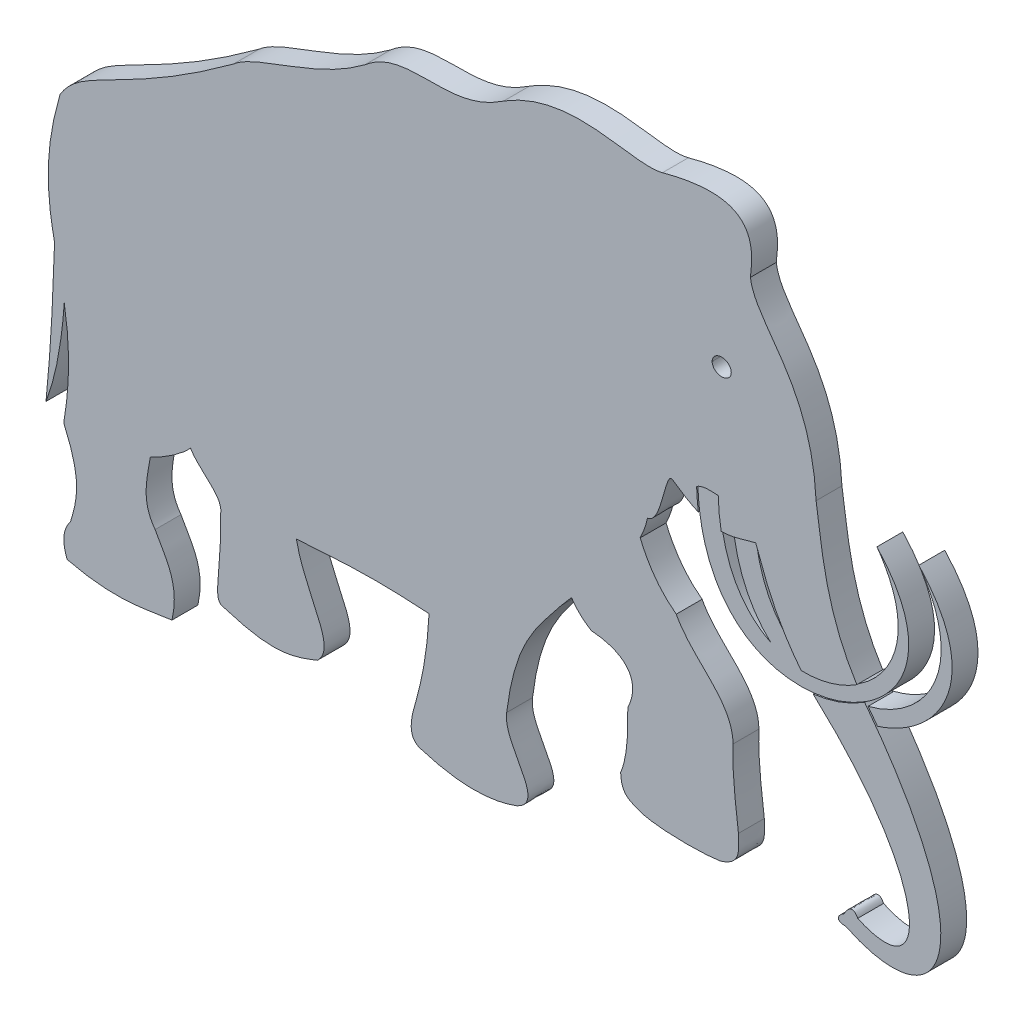
from build123d import *

# Parameters (mm, degrees)
BOSS_EXTRU_1_DEPTH   = 20
BOSS_EXTRU_1_2_DEPTH = 20
BOSS_EXTRU_2_DEPTH   = 19
BOSS_EXTRU_3_DEPTH   = 1


with BuildPart() as part:
    # Model → Boss.-Extru.1 (new body)
    with BuildSketch(Plane.XY):
        with BuildLine():
            add(Edge.make_bspline(
                [(398.406344944, -335.551266819), (400.72538222, -332.644229678), (403.475984858, -329.492972635), (406.519923296, -326.134282474)],
                knots=[14, 14, 14, 14, 14.131970446, 14.131970446, 14.131970446, 14.131970446], degree=3))
            add(Edge.make_bspline(
                [(406.519923296, -326.134282474), (409.776017564, -330.935959056), (413.953457492, -335.737862069), (421.868823242, -340.539765082)],
                knots=[0.45228017, 0.45228017, 0.45228017, 0.45228017, 1, 1, 1, 1], degree=3))
            add(Edge.make_bspline(
                [(421.868823242, -340.539765082), (445.982080078, -342.338104926), (461.195277235, -354.181309679), (450.068307834, -377.996221246)],
                knots=[1, 1, 1, 1, 2, 2, 2, 2], degree=3))
            add(Edge.make_bspline(
                [(450.068307834, -377.996221246), (449.726898872, -393.404755317), (450.721497938, -408.812944878), (444.522048611, -424.220100911)],
                knots=[2, 2, 2, 2, 3, 3, 3, 3], degree=3))
            add(Edge.make_bspline(
                [(444.522048611, -424.220100911), (444.876548937, -432.76187066), (447.047992622, -438.134152561), (455.1543023, -440.956719293)],
                knots=[3, 3, 3, 3, 4, 4, 4, 4], degree=3))
            add(Edge.make_bspline(
                [(455.1543023, -440.956719293), (467.638294813, -448.259632704), (510.63274197, -447.030767144), (521.728016493, -444.940972222)],
                knots=[4, 4, 4, 4, 5, 5, 5, 5], degree=3))
            add(Edge.make_bspline(
                [(521.728016493, -444.940972222), (538.792952474, -439.739222548), (535.34647895, -429.681610786), (535.595214844, -419.438652886)],
                knots=[5, 5, 5, 5, 6, 6, 6, 6], degree=3))
            add(Edge.make_bspline(
                [(535.595214844, -419.438652886), (534.055946181, -404.829725477), (530.511631944, -383.704399957), (531.437673611, -361.659233941)],
                knots=[6, 6, 6, 6, 7, 7, 7, 7], degree=3))
            add(Edge.make_bspline(
                [(531.437673611, -361.659233941), (530.897827148, -333.355018446), (499.979128689, -320.640549045), (487.516840278, -296.706092665)],
                knots=[7, 7, 7, 7, 8, 8, 8, 8], degree=3))
            add(Edge.make_bspline(
                [(487.516840278, -296.706092665), (473.931190857, -286.590161181), (465.776068868, -273.993395692), (459.640748441, -259.547435467)],
                knots=[8, 8, 8, 8, 8.693102404, 8.693102404, 8.693102404, 8.693102404], degree=3))
            add(Edge.make_bspline(
                [(459.640748441, -259.547435467), (462.251610075, -254.159049239), (464.222819066, -248.757530234), (465.321123589, -243.404953342)],
                knots=[14.842884852, 14.842884852, 14.842884852, 14.842884852, 15, 15, 15, 15], degree=3))
            add(Edge.make_bspline(
                [(465.321123589, -243.404953342), (476.881830512, -242.388822428), (478.685682509, -203.793245443), (484.715977648, -208.115289985)],
                knots=[15, 15, 15, 15, 16, 16, 16, 16], degree=3))
            add(Edge.make_bspline(
                [(484.715977648, -208.115289985), (492.427668085, -213.643603384), (498.92289592, -217.41222398), (504.611263002, -219.877654074)],
                knots=[16, 16, 16, 16, 16.233856891, 16.233856891, 16.233856891, 16.233856891], degree=3))
            add(Edge.make_bspline(
                [(504.611263, -219.877654075), (503.90485418, -214.632857847), (503.438771997, -209.088945624), (503.235088433, -203.235828993)],
                knots=[2.965880215, 2.965880215, 2.965880215, 2.965880215, 3, 3, 3, 3], degree=3))
            add(Edge.make_bspline(
                [(503.235088433, -203.235828993), (508.347610135, -200.100964355), (514.205995009, -200.829257541), (519.966539171, -201.050777181)],
                knots=[0, 0, 0, 0, 1, 1, 1, 1], degree=3))
            add(Edge.make_bspline(
                [(519.966539171, -201.050777181), (520.200682818, -209.345869849), (520.993778932, -216.955149154), (522.271799894, -223.91227884)],
                knots=[1, 1, 1, 1, 1.054880767, 1.054880767, 1.054880767, 1.054880767], degree=3))
            add(Edge.make_bspline(
                [(522.271799894, -223.91227884), (531.302996424, -223.911756163), (538.96560043, -220.639713415), (548.941170247, -218.199256727)],
                knots=[16.513771851, 16.513771851, 16.513771851, 16.513771851, 17, 17, 17, 17], degree=3))
            add(Edge.make_bspline(
                [(548.941170247, -218.199256727), (557.305826696, -241.591206198), (565.332861379, -262.408727181), (584.057517178, -286.121711013)],
                knots=[17, 17, 17, 17, 17.852015906, 17.852015906, 17.852015906, 17.852015906], degree=3))
            add(Edge.make_bspline(
                [(584.057517178, -286.121711013), (599.043498093, -286.7356954), (614.341231755, -282.300462193), (627.11275408, -274.106563468)],
                knots=[1.394054378, 1.394054378, 1.394054378, 1.394054378, 1.579105283, 1.579105283, 1.579105283, 1.579105283], degree=3))
            add(Edge.make_bspline(
                [(627.11275408, -274.106563468), (601.829511494, -234.304261303), (599.860519327, -192.596308406), (595.633582899, -166.705069987)],
                knots=[22.090883829, 22.090883829, 22.090883829, 22.090883829, 23, 23, 23, 23], degree=3))
            add(Edge.make_bspline(
                [(595.633582899, -166.705069987), (591.994184028, -90.859053548), (548.631456163, -71.665737576), (544.860110135, -42.511961534)],
                knots=[23, 23, 23, 23, 24, 24, 24, 24], degree=3))
            add(Edge.make_bspline(
                [(544.860110135, -42.511961534), (550.09941135, -7.926820204), (536.335910373, 9.595107693), (476.863226997, -6.4456014)],
                knots=[24, 24, 24, 24, 25, 25, 25, 25], degree=3))
            add(Edge.make_bspline(
                [(476.863226997, -6.4456014), (451.853556315, -12.988009983), (406.526090495, 13.079305013), (353.948765734, -19.970357259)],
                knots=[25, 25, 25, 25, 26, 26, 26, 26], degree=3))
            add(Edge.make_bspline(
                [(353.948765734, -19.970357259), (311.247496202, -49.233859592), (279.860781521, -21.029035102), (246.723269314, -49.274339464)],
                knots=[26, 26, 26, 26, 27, 27, 27, 27], degree=3))
            add(Edge.make_bspline(
                [(246.723269314, -49.274339464), (208.036914062, -78.330791558), (163.732986111, -83.472252062), (145.176496039, -99.525708008)],
                knots=[27, 27, 27, 27, 28, 28, 28, 28], degree=3))
            add(Edge.make_bspline(
                [(145.176496039, -99.525708008), (59.096823459, -162.770770942), (27.422098796, -159.52497423), (11.034468587, -187.039229329)],
                knots=[28, 28, 28, 28, 29, 29, 29, 29], degree=3))
            add(Edge.make_bspline(
                [(11.034468587, -187.039229329), (-2.023099135, -231.81045407), (1.238489874, -260.444268301), (6.852208523, -288.169062235)],
                knots=[29, 29, 29, 29, 29.461916965, 29.461916965, 29.461916965, 29.461916965], degree=3))
            add(Edge.make_bspline(
                [(6.852208523, -288.169062235), (5.738939319, -325.066031279), (3.892540146, -361.752643598), (0.238228353, -397.92024197)],
                knots=[0.218068822, 0.218068822, 0.218068822, 0.218068822, 1, 1, 1, 1], degree=3))
            add(Edge.make_bspline(
                [(0.238228353, -397.92024197), (8.293538339, -376.849699514), (12.444717414, -351.589245608), (14.353562416, -325.02723288)],
                knots=[1, 1, 1, 1, 1.557809134, 1.557809134, 1.557809134, 1.557809134], degree=3))
            add(Edge.make_bspline(
                [(14.353562416, -325.02723288), (18.022572947, -346.803775008), (19.709263159, -371.625256349), (13.967622884, -405.429516602)],
                knots=[29.66254018, 29.66254018, 29.66254018, 29.66254018, 30, 30, 30, 30], degree=3))
            add(Edge.make_bspline(
                [(13.967622884, -405.429516602), (27.818801541, -436.548719618), (24.819329156, -450.402826606), (19.196588813, -468.933306207)],
                knots=[30, 30, 30, 30, 31, 31, 31, 31], degree=3))
            add(Edge.make_bspline(
                [(19.196588813, -468.933306207), (13.655497233, -475.808338759), (12.266951497, -484.473098416), (16.583483887, -495.596622721)],
                knots=[31, 31, 31, 31, 32, 32, 32, 32], degree=3))
            add(Edge.make_bspline(
                [(16.583483887, -495.596622721), (53.950023058, -504.513218859), (74.400109863, -498.845692274), (97.653643121, -495.596622721)],
                knots=[0, 0, 0, 0, 1, 1, 1, 1], degree=3))
            add(Edge.make_bspline(
                [(97.653643121, -495.596622721), (103.789702691, -468.516794162), (92.472391764, -456.483075629), (84.577438694, -441.495876736)],
                knots=[1, 1, 1, 1, 2, 2, 2, 2], degree=3))
            add(Edge.make_bspline(
                [(84.577438694, -441.495876736), (73.344704861, -426.468025716), (78.563163249, -409.847162543), (80.879989963, -394.819656033)],
                knots=[2, 2, 2, 2, 3, 3, 3, 3], degree=3))
            add(Edge.make_bspline(
                [(80.879989963, -394.819656033), (88.252431553, -391.762761818), (104.013156589, -382.138123853), (111.037630985, -374.217267875)],
                knots=[3, 3, 3, 3, 3.958537003, 3.958537003, 3.958537003, 3.958537003], degree=3))
            add(Edge.make_bspline(
                [(110.986507161, -374.190424262), (111.003552827, -374.19937589), (111.020594101, -374.208323761), (111.037630985, -374.217267875)],
                knots=[1, 1, 1, 1, 1.000335984, 1.000335984, 1.000335984, 1.000335984], degree=3))
            add(Edge.make_bspline(
                [(111.528710891, -373.649251727), (111.348680842, -373.829891833), (111.167947011, -374.010282884), (110.986507161, -374.190424262)],
                knots=[0.995513041, 0.995513041, 0.995513041, 0.995513041, 1, 1, 1, 1], degree=3))
            add(Edge.make_bspline(
                [(111.528710891, -373.649251727), (111.65548452, -373.498650072), (111.77887759, -373.348751509), (111.898768446, -373.1996148)],
                knots=[3.981573417, 3.981573417, 3.981573417, 3.981573417, 4, 4, 4, 4], degree=3))
            add(Edge.make_bspline(
                [(111.898768446, -373.1996148), (111.908343526, -373.215587437), (111.917932789, -373.231550632), (111.927536181, -373.247504408)],
                knots=[4, 4, 4, 4, 4.00123389, 4.00123389, 4.00123389, 4.00123389], degree=3))
            add(Edge.make_bspline(
                [(111.927536181, -373.247504408), (119.700955902, -386.161211416), (136.732387618, -392.903284531), (135.332307943, -405.003702799)],
                knots=[4.00123389, 4.00123389, 4.00123389, 4.00123389, 5, 5, 5, 5], degree=3))
            add(Edge.make_bspline(
                [(135.332307943, -405.003702799), (136.511908637, -441.930992296), (127.738972982, -466.411151801), (137.662398275, -467.088802083)],
                knots=[5, 5, 5, 5, 6, 6, 6, 6], degree=3))
            add(Edge.make_bspline(
                [(137.662398275, -467.088802083), (174.724907769, -478.725645616), (188.909227159, -474.827175564), (210.107933214, -466.292640516)],
                knots=[6, 6, 6, 6, 7, 7, 7, 7], degree=3))
            add(Edge.make_bspline(
                [(210.107933214, -466.292640516), (225.977076552, -451.064629449), (200.850961643, -427.777506511), (193.79695638, -393.214241536)],
                knots=[7, 7, 7, 7, 8, 8, 8, 8], degree=3))
            add(Edge.make_bspline(
                [(193.79695638, -393.214241536), (226.387626349, -391.252406292), (246.931816117, -388.759060748), (296.115830378, -391.885871852)],
                knots=[8, 8, 8, 8, 8.997997611, 8.997997611, 8.997997611, 8.997997611], degree=3))
            add(Edge.make_bspline(
                [(296.115830378, -391.885871852), (296.214513521, -391.892145507), (296.313311959, -391.898441787), (296.41222602, -391.904760742)],
                knots=[8.997997611, 8.997997611, 8.997997611, 8.997997611, 9, 9, 9, 9], degree=3))
            add(Edge.make_bspline(
                [(296.41222602, -391.904760742), (295.235381402, -415.582557509), (292.040399848, -434.388644748), (286.372528754, -455.190475803)],
                knots=[9, 9, 9, 9, 10, 10, 10, 10], degree=3))
            add(Edge.make_bspline(
                [(286.372528754, -455.190475803), (284.158710395, -462.63394911), (277.440774197, -482.154204644), (289.96696913, -485.646842448)],
                knots=[10, 10, 10, 10, 11, 11, 11, 11], degree=3))
            add(Edge.make_bspline(
                [(289.96696913, -485.646842448), (317.163930935, -494.173453776), (342.141906738, -495.050230577), (364.409109158, -486.580118815)],
                knots=[11, 11, 11, 11, 12, 12, 12, 12], degree=3))
            add(Edge.make_bspline(
                [(364.409109158, -486.580118815), (388.498594835, -475.320513238), (353.052007378, -450.114127604), (356.416143121, -428.096522352)],
                knots=[12, 12, 12, 12, 13, 13, 13, 13], degree=3))
            add(Edge.make_bspline(
                [(356.416143121, -428.096522352), (362.96492513, -374.110842556), (380.865296766, -358.482166884), (398.406344944, -335.551266819)],
                knots=[13, 13, 13, 13, 14, 14, 14, 14], degree=3))
        make_face()
        with BuildLine():
            add(Edge.make_bspline(
                [(515.256060113, -113.603746202), (515.256060113, -109.97227105), (518.567485894, -107.028953722), (526.737529839, -107.028953722), (530.048611111, -109.97227105), (530.048611111, -117.235221354), (526.737529839, -120.178538683), (518.567485894, -120.178538683), (515.256060113, -117.235221354), (515.256060113, -113.603746202)],
                knots=[2, 2, 2, 2, 3, 3, 4.000759301, 4.000759301, 5.001518603, 5.001518603, 6.001518603, 6.001518603, 6.001518603, 6.001518603], degree=3))
        make_face(mode=Mode.SUBTRACT)
    extrude(amount=BOSS_EXTRU_1_DEPTH)



with BuildPart() as body_2:
    # Model → Boss.-Extru.1 2 (new body)
    with BuildSketch(Plane.XY):
        with BuildLine():
            add(Edge.make_bspline(
                [(593.426690729, -297.210868955), (593.892394474, -297.728370413), (594.363522974, -298.247506318), (594.840177409, -298.768326823)],
                knots=[17.982167222, 17.982167222, 17.982167222, 17.982167222, 18, 18, 18, 18], degree=3))
            add(Edge.make_bspline(
                [(594.840177409, -298.768326823), (684.794376628, -380.708889431), (686.463180881, -457.061162652), (627.805607096, -430.241094293)],
                knots=[18, 18, 18, 18, 19, 19, 19, 19], degree=3))
            add(Edge.make_bspline(
                [(627.805607096, -430.241094293), (623.827555339, -422.45035536), (619.188389757, -428.631545681), (617.37695855, -432.392900933)],
                knots=[19, 19, 19, 19, 20, 20, 20, 20], degree=3))
            add(Edge.make_bspline(
                [(617.37695855, -432.392900933), (614.107907444, -434.031043837), (608.299820964, -439.738189019), (618.649232313, -440.227048069)],
                knots=[20, 20, 20, 20, 21, 21, 21, 21], degree=3))
            add(Edge.make_bspline(
                [(618.649232313, -440.227048069), (688.597762044, -474.233585612), (733.398817274, -415.646291775), (635.41995714, -285.968763563)],
                knots=[21, 21, 21, 21, 22, 22, 22, 22], degree=3))
            add(Edge.make_bspline(
                [(635.41995714, -285.968763563), (634.643658851, -284.959990404), (633.8844546, -283.948787442), (633.141910053, -282.935455684)],
                knots=[22, 22, 22, 22, 22.02336887, 22.02336887, 22.02336887, 22.02336887], degree=3))
            add(Edge.make_bspline(
                [(633.141910053, -282.935455684), (621.420410158, -290.480168648), (607.602060461, -295.503713687), (593.426690723, -297.210868983)],
                knots=[2.418058533, 2.418058533, 2.418058533, 2.418058533, 2.564353069, 2.564353069, 2.564353069, 2.564353069], degree=3))
        make_face()
    extrude(amount=BOSS_EXTRU_1_2_DEPTH)


with BuildPart() as part_1:
    add(part.part)

    add(body_2.part)  # Boss.-Extru.2 merges body 2
    # Esquisse7 → Boss.-Extru.2 (add)
    with BuildSketch(Plane.XY):
        with BuildLine():
            add(Edge.make_bspline(
                [(503.235088433, -203.235828993), (509.204749891, -374.781947157), (740.571850586, -280.724983724), (641.659369575, -175.047540961)],
                knots=[2.965880215, 2.965880215, 2.965880215, 2.965880215, 3.965880215, 3.965880215, 3.965880215, 3.965880215], degree=3))
            add(Edge.make_bspline(
                [(641.659369575, -175.047540961), (685.542811502, -236.003828706), (633.128822935, -288.132191059), (584.057517178, -286.121711013)],
                knots=[1.579105283, 1.579105283, 1.579105283, 1.579105283, 2.185050905, 2.185050905, 2.185050905, 2.185050905], degree=3))
            add(Edge.make_bspline(
                [(573.036795615, -270.679874792), (576.262711605, -275.724162052), (579.895901871, -280.851423667), (584.057517178, -286.121711013)],
                knots=[17.662652615, 17.662652615, 17.662652615, 17.662652615, 17.852015906, 17.852015906, 17.852015906, 17.852015906], degree=3))
            add(Edge.make_bspline(
                [(548.381903632, -218.337521303), (552.087875365, -242.486012385), (561.158486463, -259.545874054), (573.036795615, -270.679874792)],
                knots=[1.045134939, 1.045134939, 1.045134939, 1.045134939, 1.221129753, 1.221129753, 1.221129753, 1.221129753], degree=3))
            add(Edge.make_bspline(
                [(531.280974381, -222.912173177), (536.705090916, -221.786376333), (542.089315849, -219.909215042), (548.381903631, -218.337521303)],
                knots=[16.68150912, 16.68150912, 16.68150912, 16.68150912, 16.990874111, 16.990874111, 16.990874111, 16.990874111], degree=3))
            add(Edge.make_bspline(
                [(559.460901858, -280.00988841), (545.971306018, -267.657865043), (535.65746356, -249.046030404), (531.280974381, -222.912173177)],
                knots=[2.787616047, 2.787616047, 2.787616047, 2.787616047, 2.955657113, 2.955657113, 2.955657113, 2.955657113], degree=3))
            add(Edge.make_bspline(
                [(559.460901858, -280.00988841), (537.987465663, -269.477158598), (521.201555285, -244.804145027), (519.966539171, -201.050777181)],
                knots=[1.054880767, 1.054880767, 1.054880767, 1.054880767, 1.344355337, 1.344355337, 1.344355337, 1.344355337], degree=3))
            add(Edge.make_bspline(
                [(503.235088433, -203.235828993), (508.347610135, -200.100964355), (514.205995009, -200.829257541), (519.966539171, -201.050777181)],
                knots=[0, 0, 0, 0, 1, 1, 1, 1], degree=3))
        make_face()
        with BuildLine():
            add(Edge.make_bspline(
                [(642.082713229, -294.979514854), (639.939393503, -292.015257328), (637.718981377, -289.011580962), (635.41995714, -285.968763563)],
                knots=[21.976535507, 21.976535507, 21.976535507, 21.976535507, 22, 22, 22, 22], degree=3))
            add(Edge.make_bspline(
                [(674.085297309, -171.105318197), (726.13553371, -226.715803369), (690.863049284, -279.253094331), (642.082713229, -294.979514854)],
                knots=[2, 2, 2, 2, 2.502431038, 2.502431038, 2.502431038, 2.502431038], degree=3))
            add(Edge.make_bspline(
                [(634.850031362, -285.223701656), (678.321594781, -274.381088788), (713.736527003, -226.18410466), (674.085297309, -171.105318197)],
                knots=[1.477236635, 1.477236635, 1.477236635, 1.477236635, 2, 2, 2, 2], degree=3))
            add(Edge.make_bspline(
                [(635.41995714, -285.968763563), (635.228949156, -285.720555201), (635.038976054, -285.472199737), (634.850031362, -285.223701656)],
                knots=[22, 22, 22, 22, 22.005749904, 22.005749904, 22.005749904, 22.005749904], degree=3))
        make_face()
    extrude(amount=BOSS_EXTRU_2_DEPTH)

    # Esquisse9 → Boss.-Extru.3 (add)
    with BuildSketch(Plane.XY):
        with BuildLine():
            add(Edge.make_bspline(
                [(504.611263002, -219.877654074), (511.41995288, -222.828650149), (517.072662362, -223.912579738), (522.271799894, -223.91227884)],
                knots=[16.233856891, 16.233856891, 16.233856891, 16.233856891, 16.513771851, 16.513771851, 16.513771851, 16.513771851], degree=3))
            add(Edge.make_bspline(
                [(504.611263, -219.877654075), (512.924396259, -281.599264386), (554.520276952, -301.896410986), (593.426690723, -297.210868983)],
                knots=[2.568586433, 2.568586433, 2.568586433, 2.568586433, 2.970113579, 2.970113579, 2.970113579, 2.970113579], degree=3))
            add(Edge.make_bspline(
                [(593.426690729, -297.210868955), (593.588402106, -297.390566616), (593.75076758, -297.570461351), (593.913791386, -297.750555263)],
                knots=[17.982167222, 17.982167222, 17.982167222, 17.982167222, 17.988359491, 17.988359491, 17.988359491, 17.988359491], degree=3))
            add(Edge.make_bspline(
                [(593.91379139, -297.750555257), (659.676528225, -312.292867943), (742.655624291, -244.365872145), (674.085297309, -171.105318197)],
                knots=[2.502431038, 2.502431038, 2.502431038, 2.502431038, 3.164327371, 3.164327371, 3.164327371, 3.164327371], degree=3))
            add(Edge.make_bspline(
                [(674.085297309, -171.105318197), (749.934586589, -276.466156684), (551.099522569, -356.644897461), (546.632267253, -198.340176053)],
                knots=[1.477236635, 1.477236635, 1.477236635, 1.477236635, 2.477236635, 2.477236635, 2.477236635, 2.477236635], degree=3))
            add(Edge.make_bspline(
                [(529.107411024, -200.628925239), (534.463156467, -197.34574924), (540.599216037, -198.108837891), (546.632267253, -198.340176053)],
                knots=[0, 0, 0, 0, 1, 1, 1, 1], degree=3))
            add(Edge.make_bspline(
                [(529.107411024, -200.628925239), (530.435342496, -238.787510586), (542.411654594, -264.398397667), (559.460901858, -280.00988841)],
                knots=[2.955657113, 2.955657113, 2.955657113, 2.955657113, 3.168041066, 3.168041066, 3.168041066, 3.168041066], degree=3))
            add(Edge.make_bspline(
                [(522.271799894, -223.91227884), (527.734839404, -253.651285834), (542.058561258, -271.474032762), (559.460901858, -280.00988841)],
                knots=[1.054880767, 1.054880767, 1.054880767, 1.054880767, 1.28947457, 1.28947457, 1.28947457, 1.28947457], degree=3))
        make_face()
        with BuildLine():
            add(Edge.make_bspline(
                [(633.141910053, -282.935455684), (630.996626026, -280.007840842), (628.99039868, -277.062457177), (627.11275408, -274.106563468)],
                knots=[22.02336887, 22.02336887, 22.02336887, 22.02336887, 22.090883829, 22.090883829, 22.090883829, 22.090883829], degree=3))
            add(Edge.make_bspline(
                [(641.659369575, -175.047540961), (683.010576323, -219.226897698), (666.637850425, -261.375309128), (633.141910053, -282.935455684)],
                knots=[2, 2, 2, 2, 2.418058533, 2.418058533, 2.418058533, 2.418058533], degree=3))
            add(Edge.make_bspline(
                [(627.11275408, -274.106563468), (656.161335529, -255.469698696), (672.14116235, -217.38827017), (641.659369575, -175.047540961)],
                knots=[1.579105283, 1.579105283, 1.579105283, 1.579105283, 2, 2, 2, 2], degree=3))
        make_face()
    extrude(amount=-BOSS_EXTRU_3_DEPTH)


solid = part_1.part
